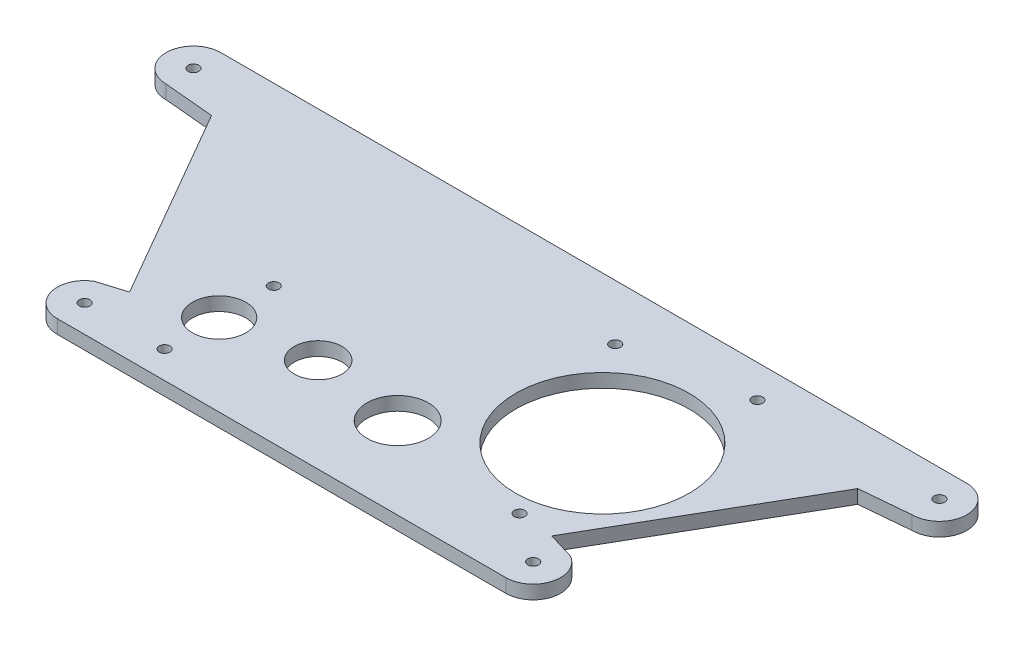
from build123d import *

# Parameters (mm, degrees)
SKETCH1_R           = 2.4892
SKETCH1_R_2         = 11.1252
SKETCH1_R_3         = 14.3002
SKETCH1_R_4         = 40.3225
SKETCH1_R_5         = 12.3825
BOSS_EXTRUDE1_DEPTH = 6.35


with BuildPart() as part:
    # Sketch1 → Boss-Extrude1 (new body)
    with BuildSketch(Plane(origin=(0, 0, 0), x_dir=(1, 0, 0), z_dir=(0, 1, 0))):
        with BuildLine():
            Line((-104.32256166, -72.590962089), (104.322561739, -72.590962089))
            ThreePointArc((104.322561739, -72.590962089), (116.589819664, -63.177963923), (110.67256166, -48.892439461))
            Line((110.67256166, -48.892439461), (98.200516404, -45.094655518))
            Line((98.200516404, -45.094655518), (150.271339409, 45.094655518))
            Line((150.271339409, 45.094655518), (173.478687828, 47.190962089))
            ThreePointArc((173.478687828, 47.190962089), (186.178687828, 59.890962094), (173.478687816, 72.590962089))
            Line((173.478687816, 72.590962089), (-173.478687828, 72.590962089))
            ThreePointArc((-173.478687828, 72.590962089), (-186.178687828, 59.890962089), (-173.478687828, 47.190962089))
            Line((-173.478687828, 47.190962089), (-150.271339409, 45.094655518))
            Line((-150.271339409, 45.094655518), (-98.200516404, -45.094655518))
            Line((-98.200516404, -45.094655518), (-110.67256166, -48.892439461))
            ThreePointArc((-110.67256166, -48.892439461), (-116.589819654, -63.177963961), (-104.32256166, -72.590962089))
        make_face()
        with Locations((-104.32256166, -59.890962089)):
            Circle(SKETCH1_R, mode=Mode.SUBTRACT)
        with Locations((91.297923401, 57.401762089)):
            Circle(SKETCH1_R, mode=Mode.SUBTRACT)
        with Locations((-26.911726221, -28.671379147)):
            Circle(SKETCH1_R_2, mode=Mode.SUBTRACT)
        with Locations((81.671791392, -43.565397329)):
            Circle(SKETCH1_R, mode=Mode.SUBTRACT)
        with Locations((15.87430952, -34.490962089)):
            Circle(SKETCH1_R_3, mode=Mode.SUBTRACT)
        with Locations((72.644027153, 3.985206637)):
            Circle(SKETCH1_R_4, mode=Mode.SUBTRACT)
        with Locations((35.710881273, 46.848232392)):
            Circle(SKETCH1_R, mode=Mode.SUBTRACT)
        with Locations((-67.13289048, -34.490962089)):
            Circle(SKETCH1_R_5, mode=Mode.SUBTRACT)
        with Locations((-67.13289048, -9.090962089)):
            Circle(SKETCH1_R, mode=Mode.SUBTRACT)
        with Locations((-67.13289048, -59.890962089)):
            Circle(SKETCH1_R, mode=Mode.SUBTRACT)
        with Locations((-173.478687828, 59.890962089)):
            Circle(SKETCH1_R, mode=Mode.SUBTRACT)
        with Locations((104.32256166, -59.890962089)):
            Circle(SKETCH1_R, mode=Mode.SUBTRACT)
        with Locations((173.478687828, 59.890962089)):
            Circle(SKETCH1_R, mode=Mode.SUBTRACT)
    extrude(amount=BOSS_EXTRUDE1_DEPTH)


solid = part.part
